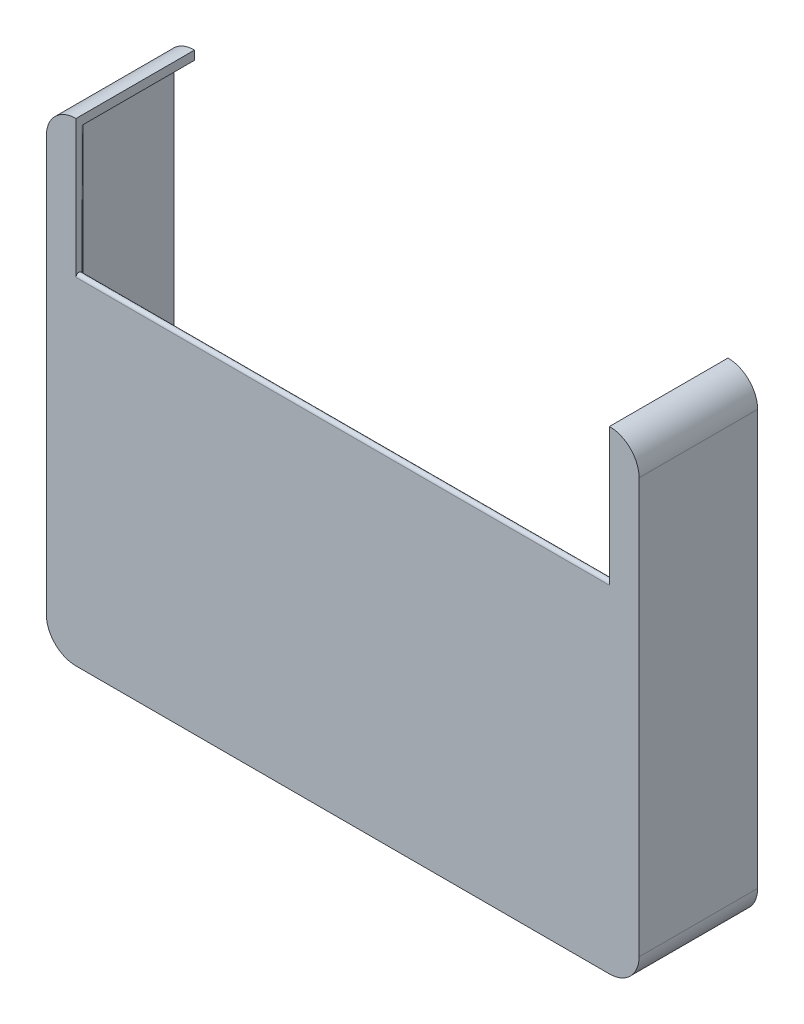
from build123d import *

# Parameters (mm, degrees)
ESQUISSE1_W             = 100
ESQUISSE1_H             = 80
BOSS_EXTRU_1_DEPTH      = 20
COQUE1_T                = -1.5
CONG_1_R                = 5
ESQUISSE3_W             = 90
ESQUISSE3_H             = 20
ENL_V_MAT_EXTRU_2_DEPTH = 20
CONG_5_R                = 20
CONG_6_R                = 0.5


with BuildPart() as part:
    # Esquisse1 → Boss.-Extru.1 (new body)
    with BuildSketch(Plane.XY):
        Rectangle(ESQUISSE1_W, ESQUISSE1_H)
    extrude(amount=BOSS_EXTRU_1_DEPTH)

    # Coque1
    coque1_openings = [part.faces().sort_by_distance(p)[0] for p in [
        (0, 0, 0),
    ]]
    offset(amount=COQUE1_T, openings=coque1_openings, kind=Kind.INTERSECTION)

    # Congé1
    cong_1_edges = [part.edges().sort_by_distance(p)[0] for p in [
        (50, -40, 10),
        (-50, -40, 10),
        (-50, 40, 10),
        (50, 40, 10),
    ]]
    fillet(cong_1_edges, radius=CONG_1_R)

    # Esquisse3 → Enlèv. mat.-Extru.2 (cut)
    with BuildSketch(Plane(origin=(0, 40, 0), x_dir=(1, 0, 0), z_dir=(0, 1, 0))):
        with Locations((0, -10)):
            Rectangle(ESQUISSE3_W, ESQUISSE3_H)
    extrude(amount=-ENL_V_MAT_EXTRU_2_DEPTH, mode=Mode.SUBTRACT)

    # Congé5
    # the kernel refuses this fillet: 20 mm, written as the material it takes off along each edge
    with BuildSketch(Plane(origin=(-45, 20, 18.5), x_dir=(0, 0, 1), z_dir=(1, 0, 0))) as cong_5_piece_1:
        with BuildLine():
            CenterArc((20, 7.599342077), CONG_5_R, 180, 22.331645009)
            Line((0, 7.599342077), (0, 0))
            Line((0, 0), (1.5, 0))
        make_face()
    extrude(amount=90, mode=Mode.SUBTRACT)

    # Congé6
    cong_6_edges = [part.edges().sort_by_distance(p)[0] for p in [
        (45, 25.450328962, 18.5),
        (0, 20, 20),
        (-45, 25.450328962, 18.5),
    ]]
    fillet(cong_6_edges, radius=CONG_6_R)


solid = part.part
